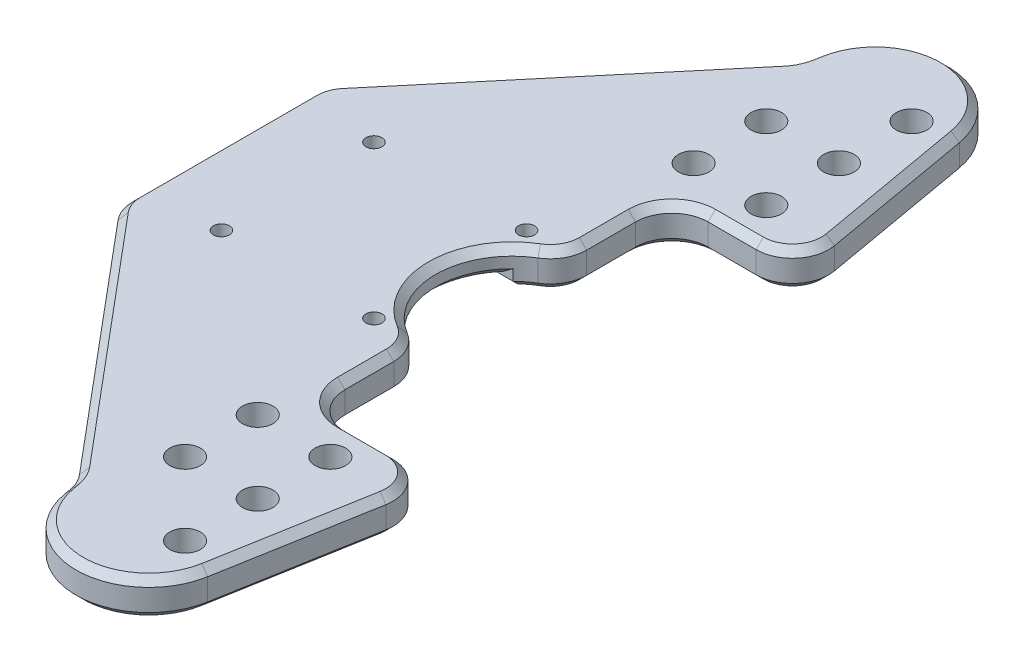
from build123d import *

# Parameters (mm, degrees)
EXTRUDE_1_DEPTH          = 2.5
SKETCH_2_R               = 2.1
CUT_EXTRUDE_1_DEPTH      = 73.284161474
SKETCH_3_R               = 1.1
CUT_EXTRUDE_2_DEPTH      = 73.284161474
SKETCH_6_W               = 36
SKETCH_6_H               = 15
CUT_EXTRUDE_3_DEPTH      = 1.5
CHAMFER_1_SIZE           = 1
CUT_EXTRUDE_4_DEPTH      = 73.284161474
CUT_EXTRUDE_4_DEPTH_BACK = 73.284161474
SKETCH_7_R               = 2.1


with BuildPart() as part:
    # 草图1 → 凸台-拉伸1 (new, symmetric)
    with BuildSketch(Plane(origin=(0, 0, 0), x_dir=(1, 0, 0), z_dir=(0, 1, 0))):
        with BuildLine():
            Line((13.527711439, -30.868240888), (9.84807753, -51.736481777))
            ThreePointArc((9.84807753, -51.736481777), (0, -60), (-9.84807753, -51.736481777))
            Line((-9.84807753, -51.736481777), (-10.017890612, -50.773423935))
            ThreePointArc((-10.017890612, -50.773423935), (-10.410390442, -49.528573514), (-11.111707161, -48.427726775))
            Line((-11.111707161, -48.427726775), (-38.830222216, -15.394086877))
            ThreePointArc((-38.830222216, -15.394086877), (-39.698463104, -13.890249545), (-40, -12.180148829))
            Line((-40, -12.180148829), (-40, 12.180148829))
            ThreePointArc((-40, 12.180148829), (-39.698463104, 13.890249545), (-38.830222216, 15.394086877))
            Line((-38.830222216, 15.394086877), (-11.111707161, 48.427726775))
            ThreePointArc((-11.111707161, 48.427726775), (-10.410390442, 49.528573514), (-10.017890612, 50.773423935))
            Line((-10.017890612, 50.773423935), (-9.84807753, 51.736481777))
            ThreePointArc((-9.84807753, 51.736481777), (0, 60), (9.84807753, 51.736481777))
            Line((9.84807753, 51.736481777), (13.527711439, 30.868240888))
            ThreePointArc((13.527711439, 30.868240888), (12.433894889, 26.786061952), (8.603672674, 25))
            Line((8.603672674, 25), (2, 25))
            ThreePointArc((2, 25), (-1.535533906, 23.535533906), (-3, 20))
            Line((-3, 20), (-3, 13.275918047))
            ThreePointArc((-3, 13.275918047), (-3.646654975, 10.816571163), (-5.419354839, 8.993363839))
            ThreePointArc((-5.419354839, 8.993363839), (-10.5, 0), (-5.419354839, -8.993363839))
            ThreePointArc((-5.419354839, -8.993363839), (-3.646654975, -10.816571163), (-3, -13.275918047))
            Line((-3, -13.275918047), (-3, -20))
            ThreePointArc((-3, -20), (-1.535533906, -23.535533906), (2, -25))
            Line((2, -25), (8.603672674, -25))
            ThreePointArc((8.603672674, -25), (12.433894889, -26.786061952), (13.527711439, -30.868240888))
        make_face()
    extrude(amount=EXTRUDE_1_DEPTH, both=True)

    # 草图2 → 切除-拉伸1 (cut, through all)
    with BuildSketch(Plane(origin=(0, 2.5, 0), x_dir=(1, 0, 0), z_dir=(0, 1, 0))):
        with Locations((5, -50)):
            Circle(SKETCH_2_R)
        with Locations((5, 50)):
            Circle(SKETCH_2_R)
    extrude(amount=-CUT_EXTRUDE_1_DEPTH, mode=Mode.SUBTRACT)

    # 草图3 → 切除-拉伸2 (cut, through all)
    with BuildSketch(Plane.XZ.offset(2.5)):
        with Locations((-8.5, 10.5)):
            Circle(SKETCH_3_R)
        with Locations((-29.5, 10.5)):
            Circle(SKETCH_3_R)
        with Locations((-29.5, -10.5)):
            Circle(SKETCH_3_R)
        with Locations((-8.5, -10.5)):
            Circle(SKETCH_3_R)
    extrude(amount=-CUT_EXTRUDE_2_DEPTH, mode=Mode.SUBTRACT)

    # 草图6 → 切除-拉伸3 (cut)
    with BuildSketch(Plane.XZ.offset(2.5)):
        with Locations((-18, 0)):
            Rectangle(SKETCH_6_W, SKETCH_6_H)
    extrude(amount=-CUT_EXTRUDE_3_DEPTH, mode=Mode.SUBTRACT)

    # 倒角1
    chamfer_1_edges = [part.edges().sort_by_distance(p)[0] for p in [
        (-9.932984071, 2.5, 51.254952856),
        (0, 2.5, 60),
        (11.687894484, 2.5, 41.302361333),
        (-9.932984071, -2.5, 51.254952856),
        (0, -2.5, 60),
        (11.687894484, -2.5, 41.302361333),
        (5.301836337, 2.5, 25),
        (12.433894889, 2.5, 26.786061952),
        (12.433894889, -2.5, 26.786061952),
        (5.301836337, -2.5, 25),
        (-9.932984071, -2.5, -51.254952856),
        (-10.410390442, -2.5, -49.528573514),
        (0, -2.5, -60),
        (-24.970964688, -2.5, -31.910906826),
        (11.687894484, -2.5, -41.302361333),
        (-39.698463104, -2.5, -13.890249545),
        (12.433894889, -2.5, -26.786061952),
        (5.301836337, -2.5, -25),
        (-39.698463104, -2.5, 13.890249545),
        (-1.535533906, -2.5, -23.535533906),
        (-24.970964688, -2.5, 31.910906826),
        (-3, -2.5, -16.637959024),
        (-10.410390442, -2.5, 49.528573514),
        (-3.646654975, -2.5, -10.816571163),
        (-3.646654975, -2.5, 10.816571163),
        (-3, -2.5, 16.637959024),
        (-1.535533906, -2.5, 23.535533906),
        (11.687894484, 2.5, -41.302361333),
        (0, 2.5, -60),
        (12.433894889, 2.5, -26.786061952),
        (-9.932984071, 2.5, -51.254952856),
        (5.301836337, 2.5, -25),
        (-10.410390442, 2.5, -49.528573514),
        (-1.535533906, 2.5, -23.535533906),
        (-24.970964688, 2.5, -31.910906826),
        (-3, 2.5, -16.637959024),
        (-39.698463104, 2.5, -13.890249545),
        (-3.646654975, 2.5, -10.816571163),
        (-40, 2.5, 0),
        (-10.5, 2.5, 0),
        (-39.698463104, 2.5, 13.890249545),
        (-3.646654975, 2.5, 10.816571163),
        (-24.970964688, 2.5, 31.910906826),
        (-3, 2.5, 16.637959024),
        (-10.410390442, 2.5, 49.528573514),
        (-1.535533906, 2.5, 23.535533906),
        (-40, -2.5, 0),
        (-10.5, -1, 0),
        (-6.427430804, -2.5, -8.302899088),
        (-21.674234614, -2.5, -7.5),
        (-21.674234614, -2.5, 7.5),
        (-36, -2.5, 0),
    ]]
    chamfer(chamfer_1_edges, length=CHAMFER_1_SIZE)

    # 草图7 → 切除-拉伸4 (cut, two sides: drawn at the far end of the back side and taken through both)
    with BuildSketch(Plane(origin=(0, 2.5, 0), x_dir=(1, 0, 0), z_dir=(0, 1, 0)).offset(-CUT_EXTRUDE_4_DEPTH_BACK)):
        with Locations((-5, 40)):
            Circle(SKETCH_7_R)
        with Locations((5, 40)):
            Circle(SKETCH_7_R)
        with Locations((5, -40)):
            Circle(SKETCH_7_R)
        with Locations((-5, -40)):
            Circle(SKETCH_7_R)
        with Locations((-5, 30)):
            Circle(SKETCH_7_R)
        with Locations((5, 30)):
            Circle(SKETCH_7_R)
        with Locations((5, -30)):
            Circle(SKETCH_7_R)
        with Locations((-5, -30)):
            Circle(SKETCH_7_R)
    extrude(amount=CUT_EXTRUDE_4_DEPTH + CUT_EXTRUDE_4_DEPTH_BACK, mode=Mode.SUBTRACT)


solid = part.part
